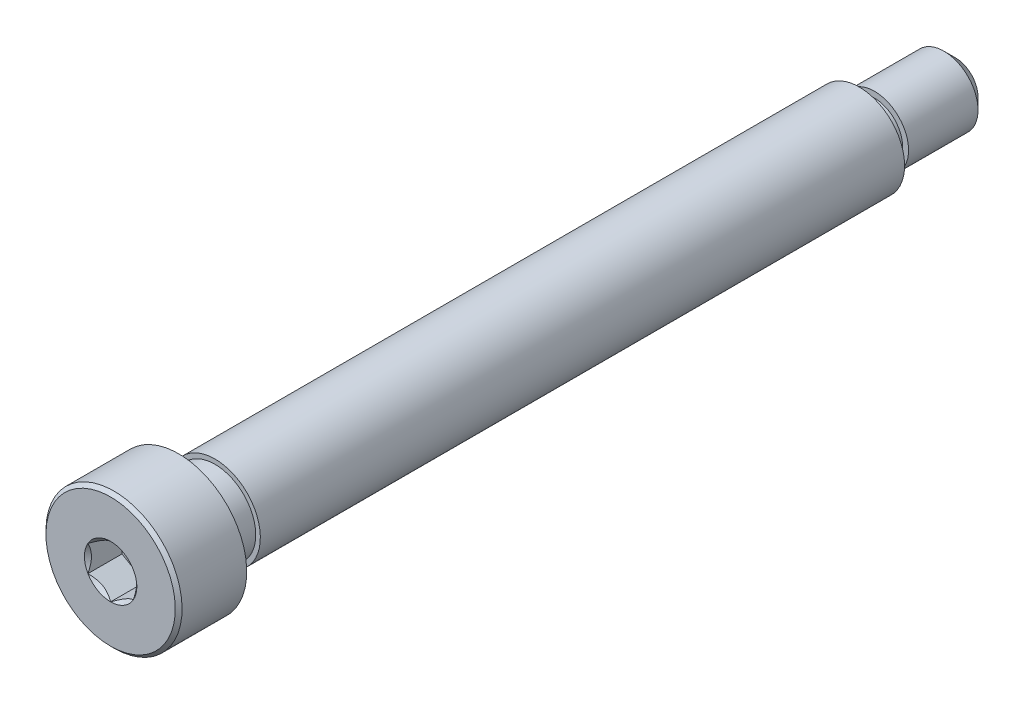
from build123d import *

# Parameters (mm, degrees)
CUT_EXTRUDE1_START = 18.621
CUT_EXTRUDE1_DEPTH = 1.5
CHAMFER2_SIZE      = 0.506148016


# Read off the part's stored shape, not the designer's step: Cut-Revolve-Thin1
with BuildPart() as part:
    # Sketch3 → Revolve1 (revolve)
    with BuildSketch(Plane(origin=(0, 0, 0), x_dir=(0, 0, -1), z_dir=(1, 0, 0)), mode=Mode.PRIVATE) as revolve1_sk:
        with BuildLine():
            Line((-18.621, 0), (-18.621, 2.805))
            Line((-18.621, 2.805), (-18.621, 3))
            Line((-18.621, 3), (-15.816, 3))
            Line((-15.816, 3), (-15.621, 3))
            Line((-15.621, 3), (-15.621, 1.797))
            Line((-15.621, 1.797), (-14.021, 1.797))
            Line((-14.021, 1.797), (-14.021, 2))
            Line((-14.021, 2), (14.379, 2))
            Line((14.379, 2), (14.379, 1.36904775))
            ThreePointArc((14.379, 1.36904775), (14.417355026, 1.276450526), (14.50995225, 1.2380955))
            Line((14.50995225, 1.2380955), (15.053864022, 1.2380955))
            Line((15.053864022, 1.2380955), (15.053864022, 1.5))
            Line((15.053864022, 1.5), (18.246, 1.5))
            Line((18.246, 1.5), (18.621, 1.5))
            Line((18.621, 1.5), (18.621, 0))
            Line((18.621, 0), (-18.621, 0))
        make_face()
    revolve(revolve1_sk.sketch.rotate(Axis((0, 0, 18.621), (0, 0, -1)), 180), axis=Axis((0, 0, 18.621), (0, 0, -1)))

    # Cut-Revolve-Thin1 outline → Cut-Revolve-Thin1 (revolve, cut)
    with BuildSketch(Plane.XZ):
        Polygon((1.758902083, 14.021398418), (1.461902083, -14.378601582), (1.5, -14.379), (1.797, 14.021), align=None)
    revolve(axis=Axis((0, 0, 0), (0, 0, 1)), mode=Mode.SUBTRACT)

    # Sketch4 → Cut-Extrude1 (cut)
    with BuildSketch(Plane.XY.offset(CUT_EXTRUDE1_START)):
        Polygon((0, 1.154700538), (-1, 0.577350269), (-1, -0.577350269), (0, -1.154700538), (1, -0.577350269), (1, 0.577350269), align=None)
    extrude(amount=-CUT_EXTRUDE1_DEPTH, mode=Mode.SUBTRACT)

    # Cut-Extrude2 cone 1 section (through the dimple's axis) → Cut-Extrude2 (revolve, cut)
    with BuildSketch(Plane(origin=(0, 0, 18.621), x_dir=(0, -1, 0), z_dir=(1, 0, 0))):
        Polygon((0, 0), (1.154700538, 0), (0, 1.154700538), align=None)
    revolve(axis=Axis((0, 0, 18.621), (0, 0, -1)), mode=Mode.SUBTRACT)

    # Chamfer2
    chamfer2_edges = [part.edges().sort_by_distance(p)[0] for p in [
        (0, 1.5, -18.621),
    ]]
    chamfer(chamfer2_edges, length=CHAMFER2_SIZE)

    # Sketch10 → Cut-Revolve2 (revolve, cut)
    with BuildSketch(Plane(origin=(0, 0, 0), x_dir=(0, 0, -1), z_dir=(1, 0, 0)), mode=Mode.PRIVATE) as cut_revolve2_sk:
        Polygon((-18.621, 2.85), (-18.471, 3), (-18.621, 3), align=None)
    revolve(cut_revolve2_sk.sketch.rotate(Axis((0, 0, 18.621), (0, 0, -1)), 180), axis=Axis((0, 0, 18.621), (0, 0, -1)), mode=Mode.SUBTRACT)


solid = part.part
